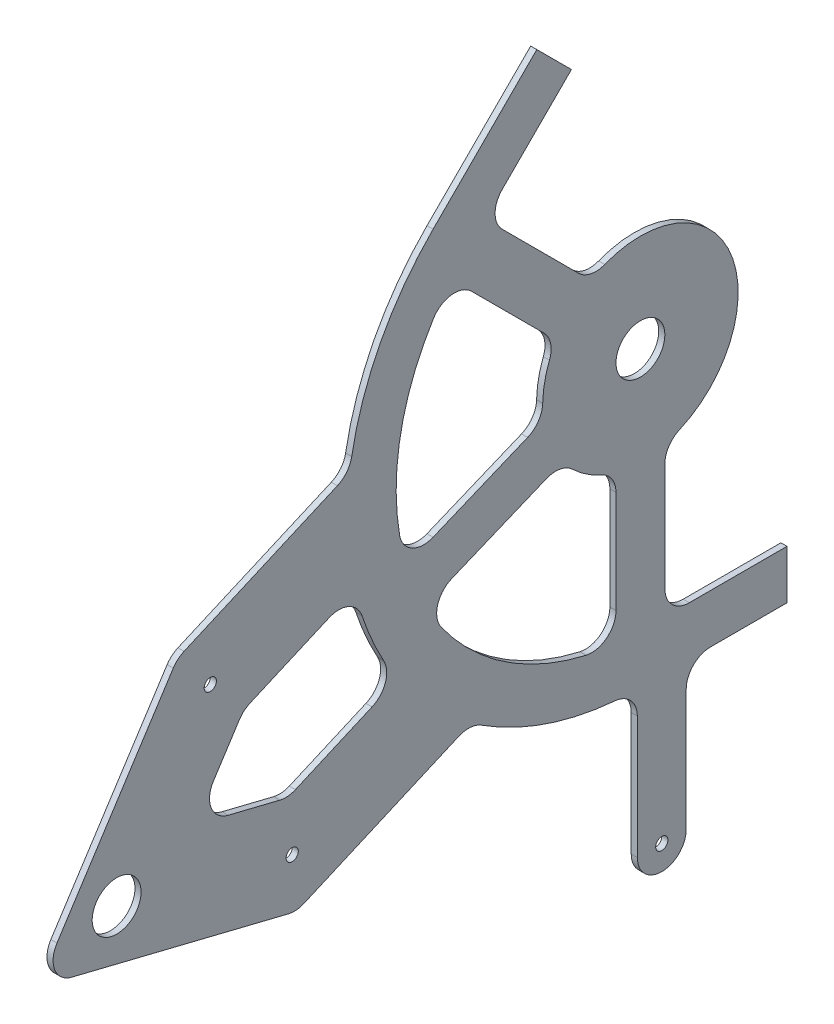
from build123d import *

# Parameters (mm, degrees)
BOSS_EXTRUDE2_DEPTH = 3.175
SKETCH11_W          = 76.2
SKETCH11_H          = 25.436159883
BOSS_EXTRUDE4_DEPTH = 3.175
SKETCH12_R          = 3.175
BOSS_EXTRUDE5_DEPTH = 3.175
SKETCH13_R          = 3.175
SKETCH13_R_2        = 12.7
BOSS_EXTRUDE6_DEPTH = 3.175
FILLET1_R           = 12.7
SKETCH14_R          = 12.7
BOSS_EXTRUDE7_DEPTH = 3.175
FILLET2_R           = 12.7


with BuildPart() as part:
    # Sketch9 → Boss-Extrude2 (new body)
    with BuildSketch(Plane(origin=(0, 0, 0), x_dir=(0, 0, -1), z_dir=(1, 0, 0))):
        with BuildLine():
            Line((0, -126.954378983), (0, -152.390538866))
            ThreePointArc((0, -152.390538866), (-140.790499807, -58.317334473), (-107.756383421, 107.756383421))
            Line((-107.756383421, 107.756383421), (-53.840601545, 161.672165297))
            Line((-53.840601545, 161.672165297), (-35.854520405, 143.686084156))
            Line((-35.854520405, 143.686084156), (-89.770302281, 89.770302281))
            ThreePointArc((-89.770302281, 89.770302281), (-117.290552306, -48.583337503), (0, -126.954378983))
        make_face()
    extrude(amount=BOSS_EXTRUDE2_DEPTH)

    # Sketch11 → Boss-Extrude4 (add)
    with BuildSketch(Plane(origin=(0, 0, 0), x_dir=(0, 0, -1), z_dir=(1, 0, 0))):
        with Locations((38.1, -139.672458925)):
            Rectangle(SKETCH11_W, SKETCH11_H)
    extrude(amount=BOSS_EXTRUDE4_DEPTH)

    # Sketch12 → Boss-Extrude5 (add)
    with BuildSketch(Plane(origin=(0, 0, 0), x_dir=(0, 0, -1), z_dir=(1, 0, 0))):
        with BuildLine():
            ThreePointArc((-1.596710848, -228.181271676), (11.103289152, -240.881271676), (23.803289152, -228.181271676))
            Line((23.803289152, -228.181271676), (23.803289152, -152.390538866))
            Line((23.803289152, -152.390538866), (0, -152.390538866))
            ThreePointArc((0, -152.390538866), (-0.79836638, -152.388447551), (-1.596710848, -152.382173664))
            Line((-1.596710848, -152.382173664), (-1.596710848, -228.181271676))
        make_face()
        with Locations((11.103289152, -228.181271676)):
            Circle(SKETCH12_R, mode=Mode.SUBTRACT)
    extrude(amount=BOSS_EXTRUDE5_DEPTH)

    # Sketch13 → Boss-Extrude6 (add)
    with BuildSketch(Plane(origin=(0, 0, 0), x_dir=(0, 0, -1), z_dir=(1, 0, 0))):
        with BuildLine():
            Line((-179.30408176, -108.723426383), (-126.094112121, -85.5754125))
            ThreePointArc((-126.094112121, -85.5754125), (-108.798735519, -106.703849441), (-88.010513932, -124.40669505))
            Line((-88.010513932, -124.40669505), (-174.796678153, -162.161411842))
            ThreePointArc((-174.796678153, -162.161411842), (-178.795504512, -163.170744037), (-182.906900508, -162.845495368))
            Line((-182.906900508, -162.845495368), (-295.609075895, -135.021776789))
            ThreePointArc((-295.609075895, -135.021776789), (-304.370626338, -127.373828039), (-303.232212873, -115.799723277))
            Line((-303.232212873, -115.799723277), (-242.800623961, -22.269934128))
            ThreePointArc((-242.800623961, -22.269934128), (-240.351404734, -19.479383865), (-237.199783408, -17.516445097))
            Line((-237.199783408, -17.516445097), (-151.079200391, 19.948722893))
            ThreePointArc((-151.079200391, 19.948722893), (-152.215522716, -7.301436858), (-148.476160922, -34.317720989))
            Line((-148.476160922, -34.317720989), (-202.860740085, -57.976727036))
            ThreePointArc((-202.860740085, -57.976727036), (-206.012361411, -59.939665804), (-208.461580638, -62.730216067))
            Line((-208.461580638, -62.730216067), (-221.913851047, -83.550254686))
            ThreePointArc((-221.913851047, -83.550254686), (-223.052264512, -95.124359447), (-214.290714069, -102.772308198))
            Line((-214.290714069, -102.772308198), (-187.414304116, -109.407509908))
            ThreePointArc((-187.414304116, -109.407509908), (-183.30290812, -109.732758578), (-179.30408176, -108.723426383))
        make_face()
        with Locations((-180.989788445, -137.156185968)):
            Circle(SKETCH13_R, mode=Mode.SUBTRACT)
        with Locations((-272.235522473, -114.629596607)):
            Circle(SKETCH13_R_2, mode=Mode.SUBTRACT)
        with Locations((-223.548763187, -39.27724509)):
            Circle(SKETCH13_R, mode=Mode.SUBTRACT)
    extrude(amount=BOSS_EXTRUDE6_DEPTH)

    # Fillet1
    fillet1_edges = [part.edges().sort_by_distance(p)[0] for p in [
        (1.5875, -34.317720989, 148.476160922),
        (1.5875, -85.5754125, 126.094112121),
        (1.5875, -124.40669505, 88.010513932),
        (1.5875, -152.382173664, 1.596710848),
        (1.5875, -152.390538866, -23.803289152),
        (1.5875, 19.948722893, 151.079200391),
    ]]
    fillet(fillet1_edges, radius=FILLET1_R)

    # Sketch14 → Boss-Extrude7 (add)
    with BuildSketch(Plane(origin=(0, 0, 0), x_dir=(0, 0, -1), z_dir=(1, 0, 0))):
        with BuildLine():
            Line((-25.800126281, 43.760638523), (-80.790046159, 98.750558402))
            Line((-80.790046159, 98.750558402), (-89.770302281, 89.770302281))
            ThreePointArc((-89.770302281, 89.770302281), (-94.153425206, 85.161886223), (-98.300254842, 80.3397426))
            Line((-98.300254842, 80.3397426), (-43.760638523, 25.800126281))
            ThreePointArc((-43.760638523, 25.800126281), (-49.823892244, 9.910588358), (-50.302839141, -7.089737254))
            Line((-50.302839141, -7.089737254), (-121.562281943, -36.60636491))
            ThreePointArc((-121.562281943, -36.60636491), (-117.290552306, -48.583337503), (-111.842122761, -60.072905036))
            Line((-111.842122761, -60.072905036), (-40.582679959, -30.55627738))
            ThreePointArc((-40.582679959, -30.55627738), (-28.222967837, -42.238656305), (-12.7, -49.186888497))
            Line((-12.7, -49.186888497), (-12.7, -126.317553583))
            ThreePointArc((-12.7, -126.317553583), (-6.357978189, -126.795072682), (0, -126.954378983))
            Line((0, -126.954378983), (12.7, -126.954378983))
            Line((12.7, -126.954378983), (12.7, -49.186888497))
            ThreePointArc((12.7, -49.186888497), (46.933080252, 19.440318364), (-25.800126281, 43.760638523))
        make_face()
        Circle(SKETCH14_R, mode=Mode.SUBTRACT)
    extrude(amount=BOSS_EXTRUDE7_DEPTH)

    # Fillet2
    fillet2_edges = [part.edges().sort_by_distance(p)[0] for p in [
        (1.5875, -7.089737254, 50.302839141),
        (1.5875, 25.800126281, 43.760638523),
        (1.5875, 80.3397426, 98.300254842),
        (1.5875, -36.60636491, 121.562281943),
        (1.5875, -60.072905036, 111.842122761),
        (1.5875, -30.55627738, 40.582679959),
        (1.5875, -49.186888497, 12.7),
        (1.5875, -126.317553583, 12.7),
        (1.5875, -126.954378983, -12.7),
        (1.5875, -49.186888497, -12.7),
        (1.5875, 43.760638523, 25.800126281),
        (1.5875, 98.750558402, 80.790046159),
    ]]
    fillet(fillet2_edges, radius=FILLET2_R)


solid = part.part
